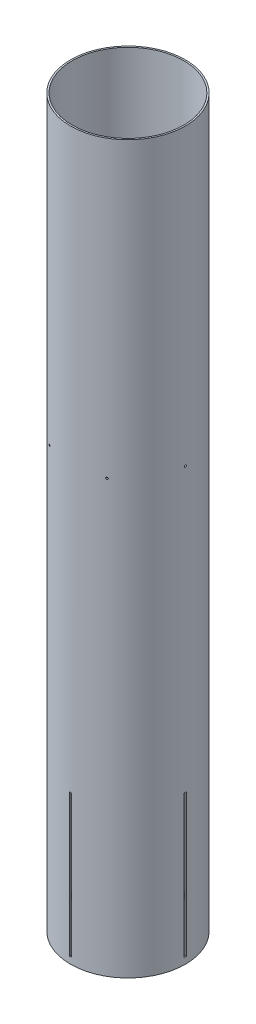
from build123d import *

# Parameters (mm, degrees)
SKETCH1_R           = 78.359
SKETCH1_R_2         = 76.2
BOSS_EXTRUDE1_DEPTH = 990.6
CUT_EXTRUDE1_DEPTH  = 997.779125866
CIRPATTERN1_COUNT   = 4
CUT_EXTRUDE2_DEPTH  = 997.779125866
CIRPATTERN2_COUNT   = 6
SKETCH3_R           = 3.175
CUT_EXTRUDE3_DEPTH  = 997.779125981


with BuildPart() as part:
    # Sketch1 → Boss-Extrude1 (new body)
    with BuildSketch(Plane(origin=(0, 0, 0), x_dir=(1, 0, 0), z_dir=(0, 1, 0))):
        Circle(SKETCH1_R)
        Circle(SKETCH1_R_2, mode=Mode.SUBTRACT)
    extrude(amount=BOSS_EXTRUDE1_DEPTH)

    # Sketch2 → Cut-Extrude1 (cut, through all)
    with BuildSketch(Plane(origin=(0, 0, 0), x_dir=(0, 0, -1), z_dir=(1, 0, 0))):
        Polygon((0, 8.89), (1.5875, 8.89), (1.5875, 203.2), (-1.5875, 203.2), (-1.5875, 8.89), align=None)
    cut_extrude1 = extrude(amount=-CUT_EXTRUDE1_DEPTH, mode=Mode.SUBTRACT)

    # CirPattern1: Cut-Extrude1 ×4 about axis
    cirpattern1_axis = Axis((0, 0, 0), (0, 1, 0))
    for i in range(1, CIRPATTERN1_COUNT):
        add(cut_extrude1.rotate(cirpattern1_axis, i * 360 / CIRPATTERN1_COUNT), mode=Mode.SUBTRACT)

    # Sketch2<3> → Cut-Extrude2 (cut, through all)
    with BuildSketch(Plane(origin=(0, 0, 0), x_dir=(0, 0, -1), z_dir=(1, 0, 0))):
        with BuildLine():
            ThreePointArc((0, 589.99755), (-0.956397277, 587.688602723), (1.35255, 588.645))
            ThreePointArc((1.35255, 588.645), (0.956397277, 589.601397277), (0, 589.99755))
        make_face()
    cut_extrude2 = extrude(amount=-CUT_EXTRUDE2_DEPTH, mode=Mode.SUBTRACT)

    # CirPattern2: Cut-Extrude2 ×6 about axis
    cirpattern2_axis = Axis((0, 990.6, 0), (0, -1, 0))
    for i in range(1, CIRPATTERN2_COUNT):
        add(cut_extrude2.rotate(cirpattern2_axis, i * 360 / CIRPATTERN2_COUNT), mode=Mode.SUBTRACT)

    # Sketch3 → Cut-Extrude3 (cut, through all)
    with BuildSketch(Plane(origin=(0, 0, 0), x_dir=(0.7071067811865477, 0, -0.7071067811865475), z_dir=(0.7071067811865475, 0, 0.7071067811865477))):
        with Locations((0, 127)):
            Circle(SKETCH3_R)
    extrude(amount=-CUT_EXTRUDE3_DEPTH, mode=Mode.SUBTRACT)


solid = part.part
